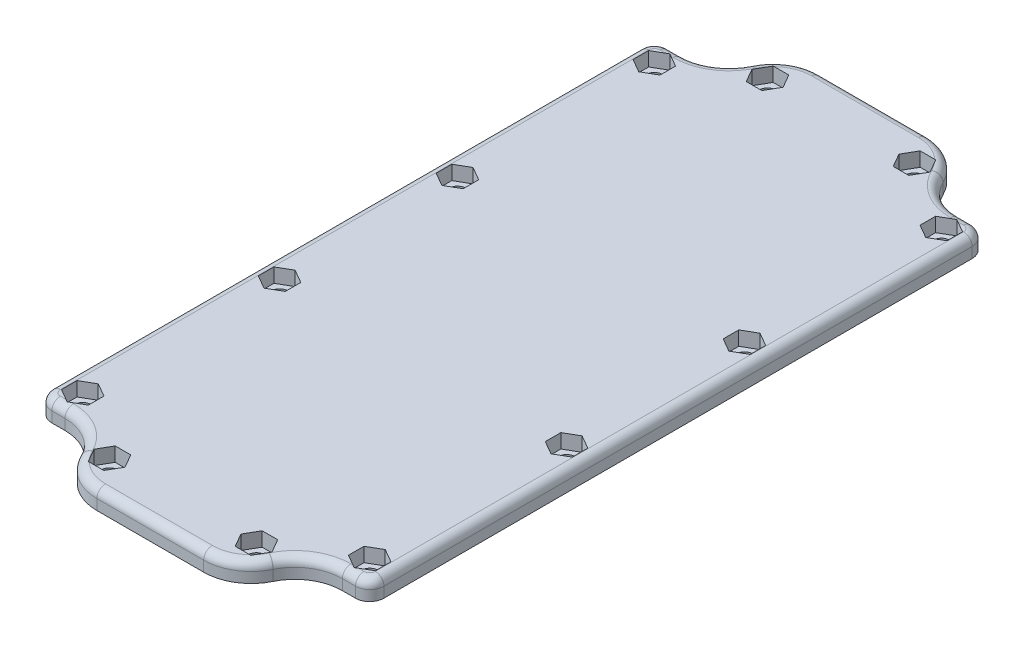
from build123d import *

# Parameters (mm, degrees)
SKETCH_1_R          = 1.75
EXTRUDE_1_DEPTH     = 4
CUT_EXTRUDE_1_DEPTH = 3
FILLET_1_R          = 1.8


with BuildPart() as part:
    # Эскиз1 → Бобышка-Вытянуть1 (new body)
    with BuildSketch(Plane(origin=(0, 0, 0), x_dir=(1, 0, 0), z_dir=(0, 1, 0))):
        with BuildLine():
            Line((-29.242090176, -65), (-32, -65))
            ThreePointArc((-32, -65), (-34.121320344, -64.121320344), (-35, -62))
            Line((-35, -62), (-35, 62))
            ThreePointArc((-35, 62), (-34.121320344, 64.121320344), (-32, 65))
            Line((-32, 65), (-29.242090176, 65))
            ThreePointArc((-29.242090176, 65), (-23.946926732, 66.517002646), (-20.258318679, 70.60775118))
            Line((-20.258318679, 70.60775118), (-20.241681321, 70.641780724))
            ThreePointArc((-20.241681321, 70.641780724), (-16.553073268, 74.732529258), (-11.257909824, 76.249531904))
            Line((-11.257909824, 76.249531904), (11.257909824, 76.249531904))
            ThreePointArc((11.257909824, 76.249531904), (16.553073268, 74.732529258), (20.241681321, 70.641780724))
            Line((20.241681321, 70.641780724), (20.258318679, 70.60775118))
            ThreePointArc((20.258318679, 70.60775118), (23.946926732, 66.517002646), (29.242090176, 65))
            Line((29.242090176, 65), (32, 65))
            ThreePointArc((32, 65), (34.121320344, 64.121320344), (35, 62))
            Line((35, 62), (35, -62))
            ThreePointArc((35, -62), (34.121320344, -64.121320344), (32, -65))
            Line((32, -65), (29.242090176, -65))
            ThreePointArc((29.242090176, -65), (23.946926732, -66.517002646), (20.258318679, -70.60775118))
            Line((20.258318679, -70.60775118), (20.241681321, -70.641780724))
            ThreePointArc((20.241681321, -70.641780724), (16.553073268, -74.732529258), (11.257909824, -76.249531904))
            Line((11.257909824, -76.249531904), (-11.257909824, -76.249531904))
            ThreePointArc((-11.257909824, -76.249531904), (-16.553073268, -74.732529258), (-20.241681321, -70.641780724))
            Line((-20.241681321, -70.641780724), (-20.258318679, -70.60775118))
            ThreePointArc((-20.258318679, -70.60775118), (-23.946926732, -66.517002646), (-29.242090176, -65))
        make_face()
        with Locations(Location((-30.25, -60.25, 0), (0, 0, 270))):
            Circle(SKETCH_1_R, mode=Mode.SUBTRACT)
        with Locations(Location((-15.490192783, -69.356022039, 0), (0, 0, 270))):
            Circle(SKETCH_1_R, mode=Mode.SUBTRACT)
        with Locations(Location((15.490192783, -69.356022039, 0), (0, 0, 270))):
            Circle(SKETCH_1_R, mode=Mode.SUBTRACT)
        with Locations(Location((30.25, -60.25, 0), (0, 0, 270))):
            Circle(SKETCH_1_R, mode=Mode.SUBTRACT)
        with Locations(Location((30.25, -18.75, 0), (0, 0, 270))):
            Circle(SKETCH_1_R, mode=Mode.SUBTRACT)
        with Locations(Location((-30.25, -18.75, 0), (0, 0, 270))):
            Circle(SKETCH_1_R, mode=Mode.SUBTRACT)
        with Locations(Location((30.25, 18.75, 0), (0, 0, 270))):
            Circle(SKETCH_1_R, mode=Mode.SUBTRACT)
        with Locations(Location((-30.25, 18.75, 0), (0, 0, 270))):
            Circle(SKETCH_1_R, mode=Mode.SUBTRACT)
        with Locations(Location((30.25, 60.25, 0), (0, 0, 270))):
            Circle(SKETCH_1_R, mode=Mode.SUBTRACT)
        with Locations(Location((15.490192783, 69.356022039, 0), (0, 0, 270))):
            Circle(SKETCH_1_R, mode=Mode.SUBTRACT)
        with Locations(Location((-30.25, 60.25, 0), (0, 0, 270))):
            Circle(SKETCH_1_R, mode=Mode.SUBTRACT)
        with Locations(Location((-15.490192783, 69.356022039, 0), (0, 0, 270))):
            Circle(SKETCH_1_R, mode=Mode.SUBTRACT)
    extrude(amount=EXTRUDE_1_DEPTH)

    # Эскиз2 → Вырез-Вытянуть1 (cut)
    with BuildSketch(Plane(origin=(0, 4, 0), x_dir=(1, 0, 0), z_dir=(0, 1, 0))):
        Polygon((-33.09, -17.110325236), (-30.25, -15.470650471), (-27.41, -17.110325236), (-27.41, -20.389674764), (-30.25, -22.029349529), (-33.09, -20.389674764), align=None)
        Polygon((-17.125421087, 66.513459511), (-13.846075573, 66.518591523), (-12.21084727, 69.361154051), (-13.854964479, 72.198584567), (-17.134309992, 72.193452555), (-18.769538296, 69.350890027), align=None)
        Polygon((-30.25, 56.970650471), (-27.41, 58.610325236), (-27.41, 61.889674764), (-30.25, 63.529349529), (-33.09, 61.889674764), (-33.09, 58.610325236), align=None)
        Polygon((-30.25, 15.470650471), (-27.41, 17.110325236), (-27.41, 20.389674764), (-30.25, 22.029349529), (-33.09, 20.389674764), (-33.09, 17.110325236), align=None)
        Polygon((-33.09, -58.610325236), (-30.25, -56.970650471), (-27.41, -58.610325236), (-27.41, -61.889674764), (-30.25, -63.529349529), (-33.09, -61.889674764), align=None)
        Polygon((-18.769538296, -69.350890027), (-17.125421087, -66.513459511), (-13.846075573, -66.518591523), (-12.21084727, -69.361154051), (-13.854964479, -72.198584567), (-17.134309992, -72.193452555), align=None)
        Polygon((17.125421087, -66.513459511), (13.846075573, -66.518591523), (12.21084727, -69.361154051), (13.854964479, -72.198584567), (17.134309992, -72.193452555), (18.769538296, -69.350890027), align=None)
        Polygon((30.25, -56.970650471), (27.41, -58.610325236), (27.41, -61.889674764), (30.25, -63.529349529), (33.09, -61.889674764), (33.09, -58.610325236), align=None)
        Polygon((30.25, -15.470650471), (27.41, -17.110325236), (27.41, -20.389674764), (30.25, -22.029349529), (33.09, -20.389674764), (33.09, -17.110325236), align=None)
        Polygon((33.09, 17.110325236), (30.25, 15.470650471), (27.41, 17.110325236), (27.41, 20.389674764), (30.25, 22.029349529), (33.09, 20.389674764), align=None)
        Polygon((33.09, 58.610325236), (30.25, 56.970650471), (27.41, 58.610325236), (27.41, 61.889674764), (30.25, 63.529349529), (33.09, 61.889674764), align=None)
        Polygon((18.769538296, 69.350890027), (17.125421087, 66.513459511), (13.846075573, 66.518591523), (12.21084727, 69.361154051), (13.854964479, 72.198584567), (17.134309992, 72.193452555), align=None)
    extrude(amount=-CUT_EXTRUDE_1_DEPTH, mode=Mode.SUBTRACT)

    # Скругление1
    # the kernel refuses this fillet: 1.8 mm, written as the material it takes off along each edge
    with BuildSketch(Plane(origin=(-29.242090176, 4, 75), x_dir=(0.8983771496615776, 0, -0.4392248819977524), z_dir=(0.4392248819977524, 0, 0.8983771496615776))) as fillet_1_piece_1:
        with BuildLine():
            CenterArc((10 + FILLET_1_R, -FILLET_1_R), FILLET_1_R, 90, 90)
            Line((10, -FILLET_1_R), (10, 0))
            Line((10, 0), (10 + FILLET_1_R, 0))
        make_face()
    revolve(axis=Axis((-29.242090176, 4, 75), (0, 1, 0)), revolution_arc=63.945563983, mode=Mode.SUBTRACT)
    with BuildSketch(Plane(origin=(-20.241681321, 4, 70.641780724), x_dir=(0.8983771496617785, 0, -0.4392248819973412), z_dir=(-0.4392248819973412, 0, -0.8983771496617786)), Plane(origin=(20.258318679, 4, 70.60775118), x_dir=(-0.898377149661431, 0, -0.439224881998052), z_dir=(-0.43922488199805204, 0, 0.8983771496614311)), Plane(origin=(20.241681321, 4, -70.641780724), x_dir=(-0.8983771496615393, 0, 0.43922488199783083), z_dir=(0.43922488199783083, 0, 0.8983771496615393)), Plane(origin=(-20.258318679, 4, -70.60775118), x_dir=(0.8983771496614101, 0, 0.43922488199809484), z_dir=(0.4392248819980949, 0, -0.8983771496614102))) as fillet_1_piece_2:
        with BuildLine():
            CenterArc((FILLET_1_R, FILLET_1_R), FILLET_1_R, 180, 90)
            Line((0, FILLET_1_R), (0, 0))
            Line((0, 0), (FILLET_1_R, 0))
        make_face()
    extrude(amount=0.037878907, mode=Mode.SUBTRACT)
    with BuildSketch(Plane(origin=(-11.257909824, 4, 66.249531904), x_dir=(0, 0, 1), z_dir=(1, 0, 0))) as fillet_1_piece_3:
        with BuildLine():
            CenterArc((10 - FILLET_1_R, FILLET_1_R), FILLET_1_R, 270, 90)
            Line((10, FILLET_1_R), (10, 0))
            Line((10, 0), (10 - FILLET_1_R, 0))
        make_face()
    revolve(axis=Axis((-11.257909824, 4, 66.249531904), (0, -1, 0)), revolution_arc=63.945563983, mode=Mode.SUBTRACT)
    with BuildSketch(Plane(origin=(11.257909824, 4, 76.249531904), x_dir=(0, 0, -1), z_dir=(-1, 0, 0)), Plane(origin=(-11.257909824, 4, -76.249531904), x_dir=(0, 0, 1), z_dir=(1, 0, 0))) as fillet_1_piece_4:
        with BuildLine():
            CenterArc((FILLET_1_R, FILLET_1_R), FILLET_1_R, 180, 90)
            Line((0, FILLET_1_R), (0, 0))
            Line((0, 0), (FILLET_1_R, 0))
        make_face()
    extrude(amount=22.515819648, mode=Mode.SUBTRACT)
    with BuildSketch(Plane(origin=(11.257909824, 4, 66.249531904), x_dir=(0.8983771496615822, 0, 0.43922488199774307), z_dir=(0.43922488199774307, 0, -0.8983771496615822))) as fillet_1_piece_5:
        with BuildLine():
            CenterArc((10 - FILLET_1_R, FILLET_1_R), FILLET_1_R, 270, 90)
            Line((10, FILLET_1_R), (10, 0))
            Line((10, 0), (10 - FILLET_1_R, 0))
        make_face()
    revolve(axis=Axis((11.257909824, 4, 66.249531904), (0, -1, 0)), revolution_arc=63.945563983, mode=Mode.SUBTRACT)
    with BuildSketch(Plane(origin=(29.242090176, 4, 75), x_dir=(0, 0, -1), z_dir=(1, 0, 0))) as fillet_1_piece_6:
        with BuildLine():
            CenterArc((10 + FILLET_1_R, -FILLET_1_R), FILLET_1_R, 90, 90)
            Line((10, -FILLET_1_R), (10, 0))
            Line((10, 0), (10 + FILLET_1_R, 0))
        make_face()
    revolve(axis=Axis((29.242090176, 4, 75), (0, 1, 0)), revolution_arc=63.945563983, mode=Mode.SUBTRACT)
    with BuildSketch(Plane(origin=(32, 4, 65), x_dir=(0, -1, 0), z_dir=(-1, 0, 0))) as fillet_1_piece_7:
        with BuildLine():
            CenterArc((FILLET_1_R, -FILLET_1_R), FILLET_1_R, 90, 90)
            Line((0, -FILLET_1_R), (0, 0))
            Line((0, 0), (FILLET_1_R, 0))
        make_face()
    extrude(amount=2.757909824, mode=Mode.SUBTRACT)
    with BuildSketch(Plane(origin=(32, 4, 62), x_dir=(1, 0, 0), z_dir=(0, 0, -1))) as fillet_1_piece_8:
        with BuildLine():
            CenterArc((3 - FILLET_1_R, FILLET_1_R), FILLET_1_R, 270, 90)
            Line((3 - FILLET_1_R, 0), (3, 0))
            Line((3, 0), (3, FILLET_1_R))
        make_face()
    revolve(axis=Axis((32, 4, 62), (0, -1, 0)), revolution_arc=90, mode=Mode.SUBTRACT)
    with BuildSketch(Plane(origin=(35, 4, -62), x_dir=(0, -1, 0), z_dir=(0, 0, 1))) as fillet_1_piece_9:
        with BuildLine():
            CenterArc((FILLET_1_R, -FILLET_1_R), FILLET_1_R, 90, 90)
            Line((0, -FILLET_1_R), (0, 0))
            Line((0, 0), (FILLET_1_R, 0))
        make_face()
    extrude(amount=124, mode=Mode.SUBTRACT)
    with BuildSketch(Plane(origin=(-32, 4, 62), x_dir=(0, 0, 1), z_dir=(1, 0, 0))) as fillet_1_piece_10:
        with BuildLine():
            CenterArc((3 - FILLET_1_R, FILLET_1_R), FILLET_1_R, 270, 90)
            Line((3, FILLET_1_R), (3, 0))
            Line((3, 0), (3 - FILLET_1_R, 0))
        make_face()
    revolve(axis=Axis((-32, 4, 62), (0, -1, 0)), revolution_arc=90, mode=Mode.SUBTRACT)
    with BuildSketch(Plane(origin=(32, 4, -62), x_dir=(-1.4819552992169822e-11, 0, -1.0), z_dir=(-1.0, 0, 1.4819552992169822e-11))) as fillet_1_piece_11:
        with BuildLine():
            CenterArc((3 - FILLET_1_R, FILLET_1_R), FILLET_1_R, 270, 90)
            Line((3, FILLET_1_R), (3, 0))
            Line((3, 0), (3 - FILLET_1_R, 0))
        make_face()
    revolve(axis=Axis((32, 4, -62), (0, -1, 0)), revolution_arc=90.000000001, mode=Mode.SUBTRACT)
    with BuildSketch(Plane(origin=(29.242090176, 4, -65), x_dir=(0, 0, 1), z_dir=(1, 0, 0)), Plane(origin=(-32, 4, -65), x_dir=(0, 0, 1), z_dir=(1, 0, 0)), Plane(origin=(-29.242090176, 4, 65), x_dir=(0, 0, -1), z_dir=(-1, 0, 0))) as fillet_1_piece_12:
        with BuildLine():
            CenterArc((FILLET_1_R, FILLET_1_R), FILLET_1_R, 180, 90)
            Line((0, FILLET_1_R), (0, 0))
            Line((0, 0), (FILLET_1_R, 0))
        make_face()
    extrude(amount=2.757909824, mode=Mode.SUBTRACT)
    with BuildSketch(Plane(origin=(29.242090176, 4, -75), x_dir=(-0.8983771496615814, 0, 0.43922488199774473), z_dir=(-0.43922488199774473, 0, -0.8983771496615814))) as fillet_1_piece_13:
        with BuildLine():
            CenterArc((10 + FILLET_1_R, -FILLET_1_R), FILLET_1_R, 90, 90)
            Line((10, -FILLET_1_R), (10, 0))
            Line((10, 0), (10 + FILLET_1_R, 0))
        make_face()
    revolve(axis=Axis((29.242090176, 4, -75), (0, 1, 0)), revolution_arc=63.945563983, mode=Mode.SUBTRACT)
    with BuildSketch(Plane(origin=(11.257909824, 4, -66.249531904), x_dir=(0, 0, -1), z_dir=(-1, 0, 0))) as fillet_1_piece_14:
        with BuildLine():
            CenterArc((10 - FILLET_1_R, FILLET_1_R), FILLET_1_R, 270, 90)
            Line((10, FILLET_1_R), (10, 0))
            Line((10, 0), (10 - FILLET_1_R, 0))
        make_face()
    revolve(axis=Axis((11.257909824, 4, -66.249531904), (0, -1, 0)), revolution_arc=63.945563983, mode=Mode.SUBTRACT)
    with BuildSketch(Plane(origin=(-11.257909824, 4, -66.249531904), x_dir=(-0.8983771496615776, 0, -0.43922488199775245), z_dir=(-0.43922488199775245, 0, 0.8983771496615776))) as fillet_1_piece_15:
        with BuildLine():
            CenterArc((10 - FILLET_1_R, FILLET_1_R), FILLET_1_R, 270, 90)
            Line((10, FILLET_1_R), (10, 0))
            Line((10, 0), (10 - FILLET_1_R, 0))
        make_face()
    revolve(axis=Axis((-11.257909824, 4, -66.249531904), (0, -1, 0)), revolution_arc=63.945563983, mode=Mode.SUBTRACT)
    with BuildSketch(Plane(origin=(-29.242090176, 4, -75), x_dir=(0, 0, 1), z_dir=(-1, 0, 0))) as fillet_1_piece_16:
        with BuildLine():
            CenterArc((10 + FILLET_1_R, -FILLET_1_R), FILLET_1_R, 90, 90)
            Line((10, -FILLET_1_R), (10, 0))
            Line((10, 0), (10 + FILLET_1_R, 0))
        make_face()
    revolve(axis=Axis((-29.242090176, 4, -75), (0, 1, 0)), revolution_arc=63.945563983, mode=Mode.SUBTRACT)
    with BuildSketch(Plane(origin=(-32, 4, -62), x_dir=(-1, 0, 0), z_dir=(0, 0, 1))) as fillet_1_piece_17:
        with BuildLine():
            CenterArc((3 - FILLET_1_R, FILLET_1_R), FILLET_1_R, 270, 90)
            Line((3, FILLET_1_R), (3, 0))
            Line((3, 0), (3 - FILLET_1_R, 0))
        make_face()
    revolve(axis=Axis((-32, 4, -62), (0, -1, 0)), revolution_arc=90, mode=Mode.SUBTRACT)
    with BuildSketch(Plane(origin=(-35, 4, 62), x_dir=(1, 0, 0), z_dir=(0, 0, -1))) as fillet_1_piece_18:
        with BuildLine():
            CenterArc((FILLET_1_R, FILLET_1_R), FILLET_1_R, 180, 90)
            Line((0, FILLET_1_R), (0, 0))
            Line((0, 0), (FILLET_1_R, 0))
        make_face()
    extrude(amount=124, mode=Mode.SUBTRACT)


solid = part.part
